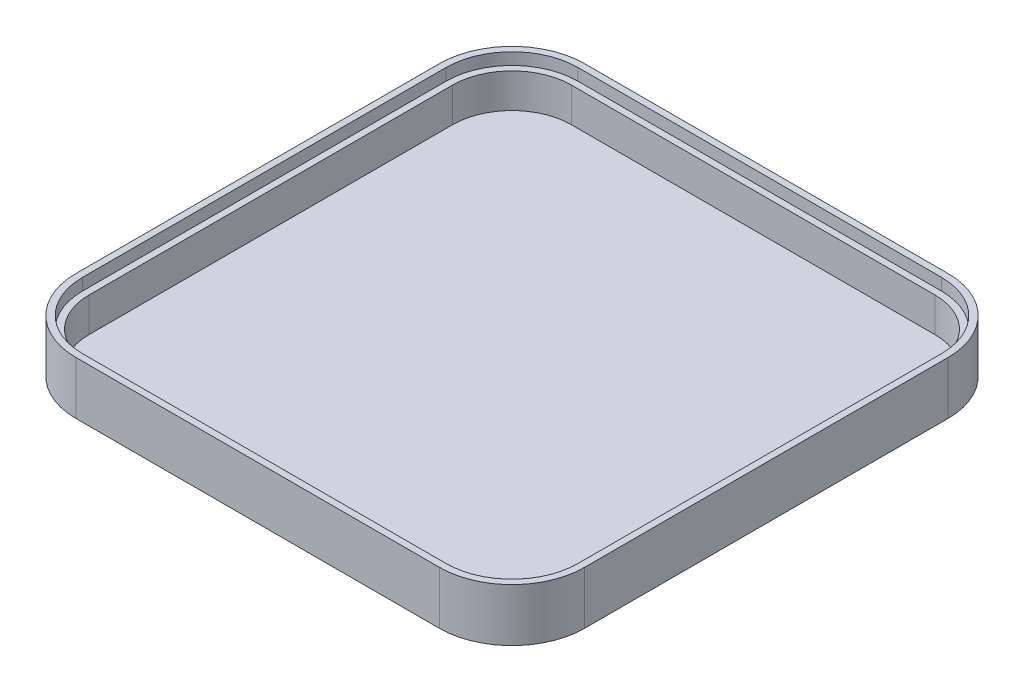
from build123d import *

# Parameters (mm, degrees)
BOSS_EXTRUDE2_DEPTH = 14
BOSS_EXTRUDE3_DEPTH = 10.4
BOSS_EXTRUDE4_START = 2
BOSS_EXTRUDE4_DEPTH = 2


with BuildPart() as part:
    # Sketch1 → Boss-Extrude2 (new body)
    with BuildSketch(Plane(origin=(0, 0, 0), x_dir=(1, 0, 0), z_dir=(0, 1, 0))):
        with BuildLine():
            Line((-55, 77), (0, 77))
            Line((0, 77), (55, 77))
            ThreePointArc((55, 77), (70.556349186, 70.556349186), (77, 55))
            Line((77, 55), (77, 0))
            Line((77, 0), (77, -55))
            ThreePointArc((77, -55), (70.556349186, -70.556349186), (55, -77))
            Line((55, -77), (0, -77))
            Line((0, -77), (-55, -77))
            ThreePointArc((-55, -77), (-70.556349186, -70.556349186), (-77, -55))
            Line((-77, -55), (-77, 0))
            Line((-77, 0), (-77, 55))
            ThreePointArc((-77, 55), (-70.556349186, 70.556349186), (-55, 77))
        make_face()
        with BuildLine():
            Line((0, 75), (55, 75))
            ThreePointArc((55, 75), (69.142135624, 69.142135624), (75, 55))
            Line((75, 55), (75, 0))
            Line((75, 0), (75, -55))
            ThreePointArc((75, -55), (69.142135624, -69.142135624), (55, -75))
            Line((55, -75), (0, -75))
            Line((0, -75), (-55, -75))
            ThreePointArc((-55, -75), (-69.142135624, -69.142135624), (-75, -55))
            Line((-75, -55), (-75, 0))
            Line((-75, 0), (-75, 55))
            ThreePointArc((-75, 55), (-69.142135624, 69.142135624), (-55, 75))
            Line((-55, 75), (0, 75))
        make_face(mode=Mode.SUBTRACT)
    extrude(amount=BOSS_EXTRUDE2_DEPTH)

    # Sketch4 → Boss-Extrude3 (add)
    with BuildSketch(Plane(origin=(0, 0, 0), x_dir=(1, 0, 0), z_dir=(0, 1, 0))):
        with BuildLine():
            Line((55, 75), (-55, 75))
            ThreePointArc((-55, 75), (-69.142135624, 69.142135624), (-75, 55))
            Line((-75, 55), (-75, -55))
            ThreePointArc((-75, -55), (-69.142135624, -69.142135624), (-55, -75))
            Line((-55, -75), (55, -75))
            ThreePointArc((55, -75), (69.142135624, -69.142135624), (75, -55))
            Line((75, -55), (75, 55))
            ThreePointArc((75, 55), (69.142135624, 69.142135624), (55, 75))
        make_face()
        with BuildLine():
            Line((55, 73), (-55, 73))
            ThreePointArc((-55, 73), (-67.727922061, 67.727922061), (-73, 55))
            Line((-73, 55), (-73, -55))
            ThreePointArc((-73, -55), (-67.727922061, -67.727922061), (-55, -73))
            Line((-55, -73), (55, -73))
            ThreePointArc((55, -73), (67.727922061, -67.727922061), (73, -55))
            Line((73, -55), (73, 55))
            ThreePointArc((73, 55), (67.727922061, 67.727922061), (55, 73))
        make_face(mode=Mode.SUBTRACT)
    extrude(amount=BOSS_EXTRUDE3_DEPTH)

    # Sketch5 → Boss-Extrude4 (add)
    with BuildSketch(Plane.XZ.offset(BOSS_EXTRUDE4_START)):
        with BuildLine():
            Line((-55, -77), (55, -77))
            ThreePointArc((55, -77), (70.556349186, -70.556349186), (77, -55))
            Line((77, -55), (77, 55))
            ThreePointArc((77, 55), (70.556349186, 70.556349186), (55, 77))
            Line((55, 77), (-55, 77))
            ThreePointArc((-55, 77), (-70.556349186, 70.556349186), (-77, 55))
            Line((-77, 55), (-77, -55))
            ThreePointArc((-77, -55), (-70.556349186, -70.556349186), (-55, -77))
        make_face()
    extrude(amount=-BOSS_EXTRUDE4_DEPTH)


solid = part.part
